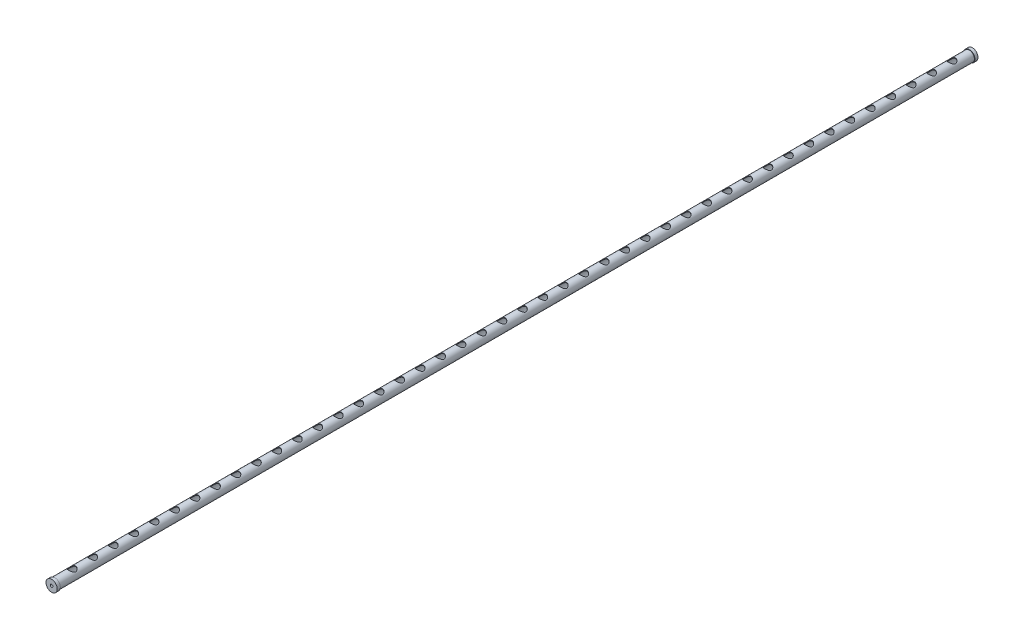
from build123d import *

# Parameters (mm, degrees)
CROQUIS1_R              = 50
CROQUIS1_R_2            = 45
SALIENTE_EXTRUIR1_DEPTH = 9000
CROQUIS2_R              = 35
CORTAR_EXTRUIR1_DEPTH   = 30
CROQUIS3_R              = 55
CROQUIS3_R_2            = 12.7
SALIENTE_EXTRUIR2_DEPTH = 30
SALIENTE_EXTRUIR3_START = -30
CROQUIS4_R              = 55
CROQUIS4_R_2            = 12.7
SALIENTE_EXTRUIR3_DEPTH = 30


with BuildPart() as part:
    # Croquis1 → Saliente-Extruir1 (new body)
    with BuildSketch(Plane.XY):
        Circle(CROQUIS1_R)
        Circle(CROQUIS1_R_2, mode=Mode.SUBTRACT)
    extrude(amount=SALIENTE_EXTRUIR1_DEPTH)

    # Croquis2 → Cortar-Extruir1 (cut)
    with BuildSketch(Plane(origin=(0, 50, 0), x_dir=(1, 0, 0), z_dir=(0, 1, 0))):
        with Locations((0, -8800)):
            Circle(CROQUIS2_R)
        with Locations((0, -8600)):
            Circle(CROQUIS2_R)
        with Locations((0, -8400)):
            Circle(CROQUIS2_R)
        with Locations((0, -8200)):
            Circle(CROQUIS2_R)
        with Locations((0, -8000)):
            Circle(CROQUIS2_R)
        with Locations((0, -7800)):
            Circle(CROQUIS2_R)
        with Locations((0, -7600)):
            Circle(CROQUIS2_R)
        with Locations((0, -7400)):
            Circle(CROQUIS2_R)
        with Locations((0, -7200)):
            Circle(CROQUIS2_R)
        with Locations((0, -7000)):
            Circle(CROQUIS2_R)
        with Locations((0, -6800)):
            Circle(CROQUIS2_R)
        with Locations((0, -6600)):
            Circle(CROQUIS2_R)
        with Locations((0, -6400)):
            Circle(CROQUIS2_R)
        with Locations((0, -6200)):
            Circle(CROQUIS2_R)
        with Locations((0, -6000)):
            Circle(CROQUIS2_R)
        with Locations((0, -5800)):
            Circle(CROQUIS2_R)
        with Locations((0, -5600)):
            Circle(CROQUIS2_R)
        with Locations((0, -5400)):
            Circle(CROQUIS2_R)
        with Locations((0, -5200)):
            Circle(CROQUIS2_R)
        with Locations((0, -5000)):
            Circle(CROQUIS2_R)
        with Locations((0, -4800)):
            Circle(CROQUIS2_R)
        with Locations((0, -4600)):
            Circle(CROQUIS2_R)
        with Locations((0, -4400)):
            Circle(CROQUIS2_R)
        with Locations((0, -4200)):
            Circle(CROQUIS2_R)
        with Locations((0, -4000)):
            Circle(CROQUIS2_R)
        with Locations((0, -3800)):
            Circle(CROQUIS2_R)
        with Locations((0, -3600)):
            Circle(CROQUIS2_R)
        with Locations((0, -3400)):
            Circle(CROQUIS2_R)
        with Locations((0, -3200)):
            Circle(CROQUIS2_R)
        with Locations((0, -3000)):
            Circle(CROQUIS2_R)
        with Locations((0, -2800)):
            Circle(CROQUIS2_R)
        with Locations((0, -2600)):
            Circle(CROQUIS2_R)
        with Locations((0, -2400)):
            Circle(CROQUIS2_R)
        with Locations((0, -2200)):
            Circle(CROQUIS2_R)
        with Locations((0, -2000)):
            Circle(CROQUIS2_R)
        with Locations((0, -1800)):
            Circle(CROQUIS2_R)
        with Locations((0, -1600)):
            Circle(CROQUIS2_R)
        with Locations((0, -1400)):
            Circle(CROQUIS2_R)
        with Locations((0, -1200)):
            Circle(CROQUIS2_R)
        with Locations((0, -1000)):
            Circle(CROQUIS2_R)
        with Locations((0, -800)):
            Circle(CROQUIS2_R)
        with Locations((0, -600)):
            Circle(CROQUIS2_R)
        with Locations((0, -400)):
            Circle(CROQUIS2_R)
        with Locations((0, -200)):
            Circle(CROQUIS2_R)
    extrude(amount=-CORTAR_EXTRUIR1_DEPTH, mode=Mode.SUBTRACT)

    # Croquis3 → Saliente-Extruir2 (add)
    with BuildSketch(Plane.XY):
        Circle(CROQUIS3_R)
        Circle(CROQUIS3_R_2, mode=Mode.SUBTRACT)
    extrude(amount=SALIENTE_EXTRUIR2_DEPTH)

    # Croquis4 → Saliente-Extruir3 (add)
    with BuildSketch(Plane.XY.offset(9000).offset(SALIENTE_EXTRUIR3_START)):
        Circle(CROQUIS4_R)
        Circle(CROQUIS4_R_2, mode=Mode.SUBTRACT)
    extrude(amount=SALIENTE_EXTRUIR3_DEPTH)


solid = part.part
